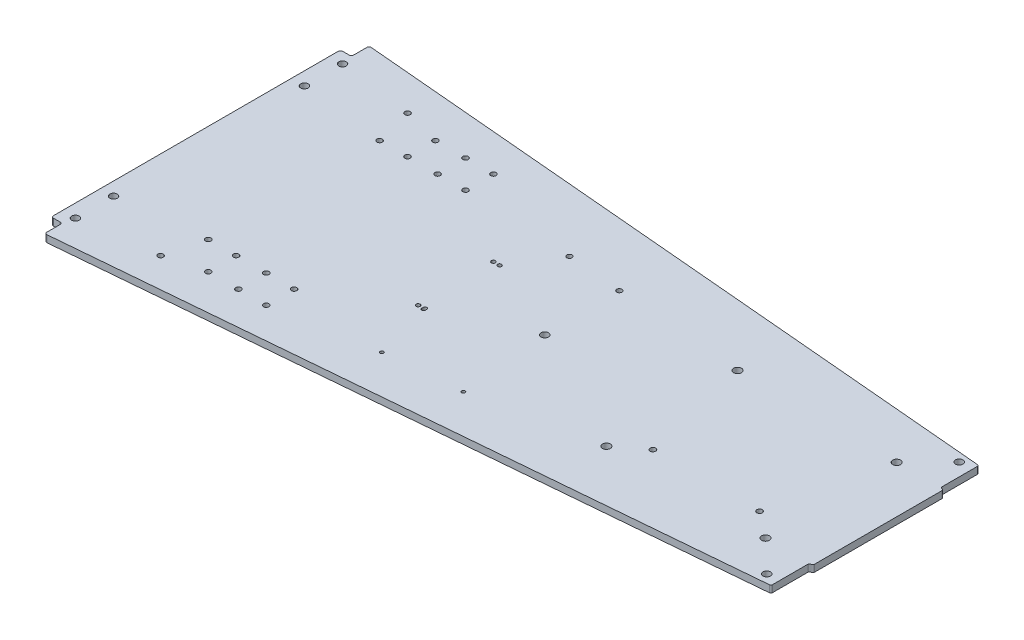
from build123d import *

# Parameters (mm, degrees)
BOSS_EXTRUDE1_DEPTH         = 3.175
M3_CLEARANCE_HOLE1_D        = 3.6
F_1_4_CLEARANCE_HOLE1_D     = 7.14248
CUT_EXTRUDE1_DEPTH          = 640.11012417
F_8_CLEARANCE_HOLE1_D       = 4.9149
SKETCH15_R                  = 1.55
CUT_EXTRUDE2_DEPTH          = 640.11012417
SKETCH16_R                  = 3.3782
CUT_EXTRUDE3_DEPTH          = 640.11012417
FILLET1_R                   = 1
CUT_EXTRUDE4_DEPTH          = 640.088878697
FILLET2_R                   = 1.5
F_13_0_185_DIAMETER_HOLE1_D = 4.699
F_1_4_CLEARANCE_HOLE2_D     = 6.7564
SKETCH23_W                  = 10
SKETCH23_H                  = 17
CUT_EXTRUDE5_DEPTH          = 640.088878697
FILLET3_R                   = 2
F_5_0MM_DOWEL_HOLE1_D       = 5


with BuildPart() as part:
    # Sketch1 → Boss-Extrude1 (new, symmetric)
    with BuildSketch(Plane(origin=(0, 0, 0), x_dir=(1, 0, 0), z_dir=(0, 1, 0))):
        Polygon((0, -94.3735), (0, 94.3735), (-621.526239041, 148.75), (-621.526239041, -148.75), align=None)
    extrude(amount=BOSS_EXTRUDE1_DEPTH, both=True)

    # M3 Clearance Hole1 (through all)
    with Locations(Plane(origin=(0, 3.175, 0), x_dir=(1, 0, 0), z_dir=(0, 1, 0))):
        with Locations((-379.222, 34.29), (-384.81, 34.29), (-384.81, -34.29)):
            Hole(M3_CLEARANCE_HOLE1_D / 2)

    # 1/4 Clearance Hole1 (through all)
    with Locations(Plane(origin=(0, 3.175, 0), x_dir=(1, 0, 0), z_dir=(0, 1, 0))):
        with Locations((-187.837254031, 59.752653333), (-42.931947364, 59.752653333), (-42.931947364, -59.752653333), (-187.837254031, -59.752653333)):
            Hole(F_1_4_CLEARANCE_HOLE1_D / 2)

    # Sketch12 → Cut-Extrude1 (cut, through all)
    with BuildSketch(Plane(origin=(0, 3.175, 0), x_dir=(1, 0, 0), z_dir=(0, 1, 0))):
        with BuildLine():
            Line((-380.84125, -33.6169), (-380.84125, -34.0868))
            ThreePointArc((-380.84125, -34.0868), (-380.85395, -34.29), (-380.84125, -34.4932))
            Line((-380.84125, -34.4932), (-380.84125, -34.9631))
            ThreePointArc((-380.84125, -34.9631), (-379.222, -36.58235), (-377.60275, -34.9631))
            Line((-377.60275, -34.9631), (-377.60275, -34.4932))
            ThreePointArc((-377.60275, -34.4932), (-377.59005, -34.29), (-377.60275, -34.0868))
            Line((-377.60275, -34.0868), (-377.60275, -33.6169))
            ThreePointArc((-377.60275, -33.6169), (-379.222, -31.99765), (-380.84125, -33.6169))
        make_face()
    extrude(amount=-CUT_EXTRUDE1_DEPTH, mode=Mode.SUBTRACT)

    # #8 Clearance Hole1 (through all)
    with Locations(Plane(origin=(0, 3.175, 0), x_dir=(1, 0, 0), z_dir=(0, 1, 0))):
        with Locations((-506.81796477, -78.064272283), (-506.81796477, -103.464272283), (-541.198220891, -112.444528404), (-532.21796477, -78.064272283), (-479.392709852, -78.064272283), (-479.392709852, -103.464272283), (-453.992709852, -78.064272283), (-453.992709852, -103.464272283), (-453.992709852, 78.064272283), (-453.992709852, 103.464272283), (-479.392709852, 78.064272283), (-479.392709852, 103.464272283), (-541.198220891, 112.444528404), (-532.21796477, 78.064272283), (-506.81796477, 103.464272283), (-506.81796477, 78.064272283)):
            Hole(F_8_CLEARANCE_HOLE1_D / 2)

    # Sketch15 → Cut-Extrude2 (cut, through all)
    with BuildSketch(Plane(origin=(0, 3.175, 0), x_dir=(1, 0, 0), z_dir=(0, 1, 0))):
        with Locations(Location((-295.918163181, -81.916960017, 0), (0, 0, 270))):
            Circle(SKETCH15_R)
        with Locations(Location((-364.1575, -87.887128395, 0), (0, 0, 270))):
            Circle(SKETCH15_R)
    extrude(amount=-CUT_EXTRUDE2_DEPTH, mode=Mode.SUBTRACT)

    # Sketch16 → Cut-Extrude3 (cut, through all)
    with BuildSketch(Plane(origin=(0, 3.175, 0), x_dir=(1, 0, 0), z_dir=(0, 1, 0))):
        with Locations(Location((-609.6000104, -121.650317511, 0), (0, 0, 270))):
            Circle(SKETCH16_R)
        with Locations(Location((-609.6000104, -86.943080709, 0), (0, 0, 270))):
            Circle(SKETCH16_R)
        with Locations(Location((-609.6000104, 86.943080709, 0), (0, 0, 270))):
            Circle(SKETCH16_R)
        with Locations(Location((-609.6000104, 121.650317511, 0), (0, 0, 270))):
            Circle(SKETCH16_R)
    extrude(amount=-CUT_EXTRUDE3_DEPTH, mode=Mode.SUBTRACT)

    # Fillet1
    fillet1_edges = [part.edges().sort_by_distance(p)[0] for p in [
        (-621.526239041, 0, 148.75),
        (-621.526239041, 0, -148.75),
    ]]
    fillet(fillet1_edges, radius=FILLET1_R)

    # Sketch17 → Cut-Extrude4 (cut, through all)
    with BuildSketch(Plane(origin=(0, 3.175, 0), x_dir=(1, 0, 0), z_dir=(0, 1, 0))):
        Polygon((-3, 94.635965991), (-3, 59.635965991), (0, 59.635965991), (0, 94.3735), align=None)
    cut_extrude4 = extrude(amount=-CUT_EXTRUDE4_DEPTH, mode=Mode.SUBTRACT)

    # Mirror1: Cut-Extrude4 across plane
    add(cut_extrude4.mirror(Plane.XY), mode=Mode.SUBTRACT)

    # Fillet2
    fillet2_edges = [part.edges().sort_by_distance(p)[0] for p in [
        (0, 0, -59.635965991),
        (-3, 0, -59.635965991),
        (-3, 0, -94.635965991),
        (0, 0, 59.635965991),
        (-3, 0, 59.635965991),
        (-3, 0, 94.635965991),
    ]]
    fillet(fillet2_edges, radius=FILLET2_R - 0.0001)  # a hair under: the kernel refuses the full size

    # #13 (0.185) Diameter Hole1 (through all)
    with Locations(Plane(origin=(0, 3.175, 0), x_dir=(1, 0, 0), z_dir=(0, 1, 0))):
        with Locations((-354.44558465, 73.187743603), (-304.635849746, 68.829956465)):
            Hole(F_13_0_185_DIAMETER_HOLE1_D / 2)

    # 1/4 Clearance Hole2 (through all)
    with Locations(Plane(origin=(0, 3.175, 0), x_dir=(1, 0, 0), z_dir=(0, 1, 0))):
        with Locations((-14.732, 88.469940408), (-14.0462, -87.453940528), (-303.7332, 0)):
            Hole(F_1_4_CLEARANCE_HOLE2_D / 2)

    # Sketch23 → Cut-Extrude5 (cut, through all)
    with BuildSketch(Plane(origin=(0, 3.175, 0), x_dir=(1, 0, 0), z_dir=(0, 1, 0))):
        with Locations((-616.526239041, 140.158691499)):
            Rectangle(SKETCH23_W, SKETCH23_H)
        with Locations((-616.526239041, -140.158691499)):
            Rectangle(SKETCH23_W, SKETCH23_H)
    extrude(amount=-CUT_EXTRUDE5_DEPTH, mode=Mode.SUBTRACT)

    # Fillet3
    fillet3_edges = [part.edges().sort_by_distance(p)[0] for p in [
        (-611.526239041, 0, -147.875113365),
        (-621.526239041, 0, -131.658691499),
        (-611.526239041, 0, -131.658691499),
        (-611.526239041, 0, 147.875113365),
        (-611.526239041, 0, 131.658691499),
        (-621.526239041, 0, 131.658691499),
    ]]
    fillet(fillet3_edges, radius=FILLET3_R)

    # Ø5.0mm Dowel Hole1 (through all)
    with Locations(Plane(origin=(0, 3.175, 0), x_dir=(1, 0, 0), z_dir=(0, 1, 0))):
        with Locations((-163.962100698, -41.275), (-66.807100698, -41.275)):
            Hole(F_5_0MM_DOWEL_HOLE1_D / 2)


solid = part.part
